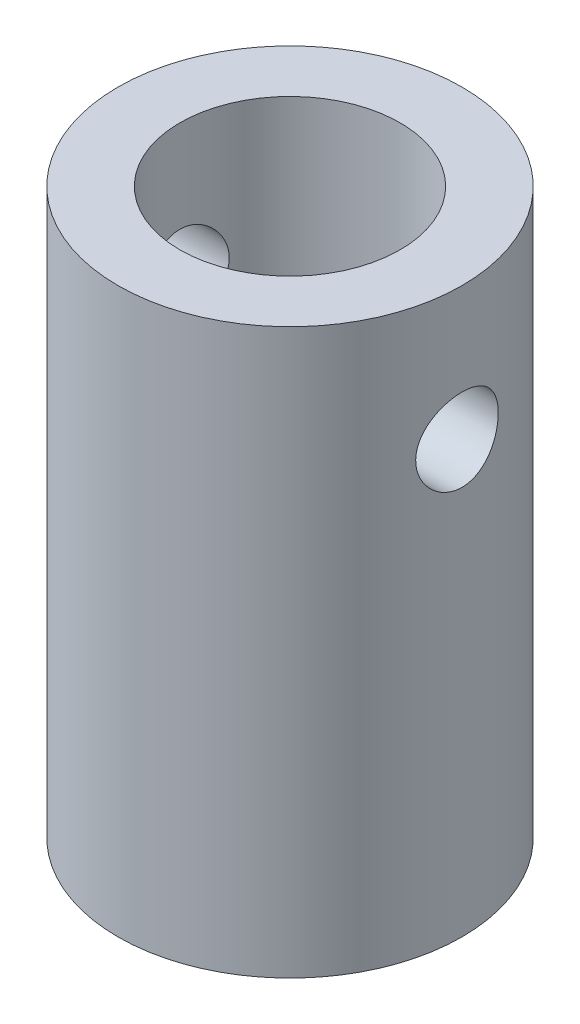
from build123d import *

# Parameters (mm, degrees)
SKETCH_1_R               = 12.5
SKETCH_1_R_2             = 8.001
EXTRUDE_1_DEPTH          = 41
CUT_EXTRUDE_2_DEPTH      = 45.648628198
CUT_EXTRUDE_2_DEPTH_BACK = 45.648628198
SKETCH_4_R               = 3


with BuildPart() as part:
    # 草图1 → 凸台-拉伸1 (new body)
    with BuildSketch(Plane(origin=(0, 0, 0), x_dir=(1, 0, 0), z_dir=(0, 1, 0))):
        Circle(SKETCH_1_R)
        Circle(SKETCH_1_R_2, mode=Mode.SUBTRACT)
    extrude(amount=EXTRUDE_1_DEPTH)

    # 草图4 → 切除-拉伸2 (cut, two sides: drawn at the far end of the back side and taken through both)
    with BuildSketch(Plane(origin=(0, 0, 0), x_dir=(0, 0, -1), z_dir=(1, 0, 0)).offset(-CUT_EXTRUDE_2_DEPTH_BACK)):
        with Locations((0, 31.3)):
            Circle(SKETCH_4_R)
    extrude(amount=CUT_EXTRUDE_2_DEPTH + CUT_EXTRUDE_2_DEPTH_BACK, mode=Mode.SUBTRACT)


solid = part.part
